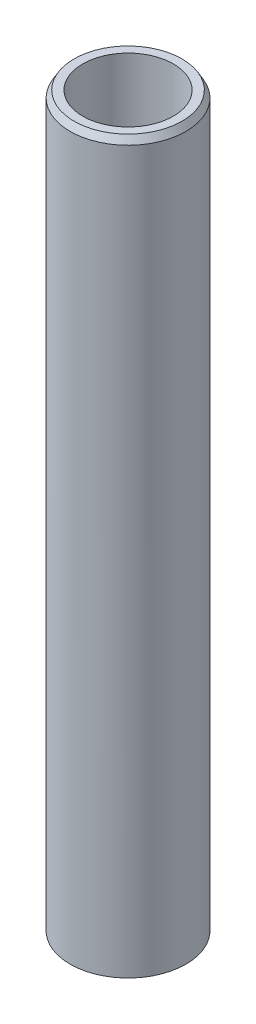
from build123d import *
from OCP.BRepFilletAPI import BRepFilletAPI_MakeChamfer

# Parameters (mm, degrees)
SKETCH1_R           = 47.5
BOSS_EXTRUDE1_DEPTH = 600
SKETCH2_R           = 37.147316009
CUT_EXTRUDE1_DEPTH  = 604.748706003
CHAMFER1_SIZE       = 5.625970049
CHAMFER1_SIZE2      = 3.248155322


with BuildPart() as part:
    # Sketch1 → Boss-Extrude1 (new body)
    with BuildSketch(Plane(origin=(0, 0, 0), x_dir=(1, 0, 0), z_dir=(0, 1, 0))):
        Circle(SKETCH1_R)
    extrude(amount=BOSS_EXTRUDE1_DEPTH)

    # Sketch2 → Cut-Extrude1 (cut, through all)
    with BuildSketch(Plane(origin=(0, 0, 0), x_dir=(1, 0, 0), z_dir=(0, 1, 0))):
        Circle(SKETCH2_R)
    extrude(amount=CUT_EXTRUDE1_DEPTH, mode=Mode.SUBTRACT)

    # Chamfer1: one chamfer whose edges measure the first distance from different faces: ONE call of the kernel's chamfer builder (chamfer() names one face for all edges)
    chamfer1_edges_1 = [part.edges().sort_by_distance(p)[0] for p in [
        (-47.5, 600, 0),
    ]]
    chamfer1_side_1 = [part.faces().sort_by_distance(p)[0] for p in [
        (-47.5, 300, 0),
    ]]
    chamfer1_edges_2 = [part.edges().sort_by_distance(p)[0] for p in [
        (-47.5, 0, 0),
    ]]
    chamfer1_side_2 = [part.faces().sort_by_distance(p)[0] for p in [
        (-46.156497116, 0, 0),
    ]]
    chamfer1 = BRepFilletAPI_MakeChamfer(part.part.solid().wrapped)
    for e in chamfer1_edges_1:
        chamfer1.Add(CHAMFER1_SIZE, CHAMFER1_SIZE2, e.wrapped, chamfer1_side_1[0].wrapped)  # the first distance lies on this face
    for e in chamfer1_edges_2:
        chamfer1.Add(CHAMFER1_SIZE, CHAMFER1_SIZE2, e.wrapped, chamfer1_side_2[0].wrapped)  # the first distance lies on this face
    add(Compound.cast(chamfer1.Shape()), mode=Mode.REPLACE)


solid = part.part
